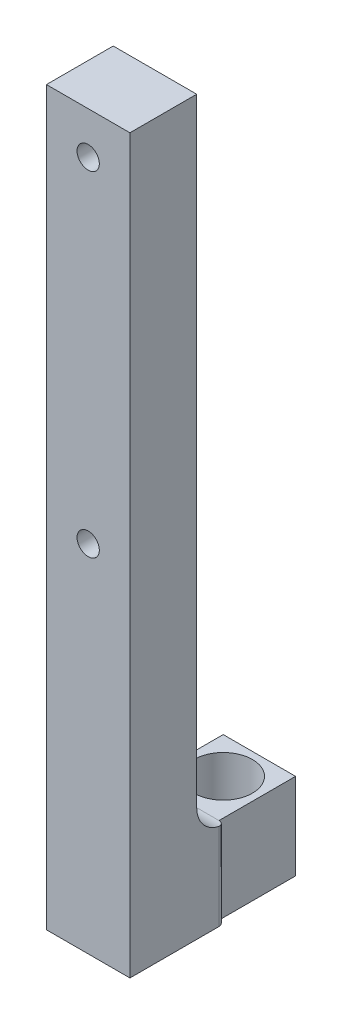
from build123d import *

# Parameters (mm, degrees)
SKETCH1_W           = 6.5
SKETCH1_H           = 6.5
SKETCH1_R           = 2.625
BOSS_EXTRUDE1_DEPTH = 7.75
SKETCH2_W           = 6.5
SKETCH2_H           = 7.75
BOSS_EXTRUDE2_DEPTH = 8.88
SKETCH3_W           = 6.5
SKETCH3_H           = 6
BOSS_EXTRUDE3_DEPTH = 58.01
FILLET1_R           = 2.5
BOSS_EXTRUDE4_START = 0.5
BOSS_EXTRUDE4_DEPTH = 0.5
FILLET2_R           = 0.5
FILLET3_R           = 0.5
SKETCH6_R           = 1
CUT_EXTRUDE3_DEPTH  = 67.53137982
CUT_EXTRUDE4_DEPTH  = 2


with BuildPart() as part:
    # Sketch1 → Boss-Extrude1 (new body)
    with BuildSketch(Plane(origin=(0, 0, 0), x_dir=(1, 0, 0), z_dir=(0, 1, 0))):
        Rectangle(SKETCH1_W, SKETCH1_H)
        with Locations(Location((0, 0, 0), (0, 0, 270))):
            Circle(SKETCH1_R, mode=Mode.SUBTRACT)
    extrude(amount=BOSS_EXTRUDE1_DEPTH)

    # Sketch2 → Boss-Extrude2 (add)
    with BuildSketch(Plane.XY.offset(3.25)):
        with Locations((0, 3.875)):
            Rectangle(SKETCH2_W, SKETCH2_H)
    extrude(amount=BOSS_EXTRUDE2_DEPTH)

    # Sketch3 → Boss-Extrude3 (add)
    with BuildSketch(Plane(origin=(0, 7.75, 0), x_dir=(1, 0, 0), z_dir=(0, 1, 0))):
        with Locations((0, -9.13)):
            Rectangle(SKETCH3_W, SKETCH3_H)
    extrude(amount=BOSS_EXTRUDE3_DEPTH)

    # Fillet1
    fillet1_edges = [part.edges().sort_by_distance(p)[0] for p in [
        (0, 7.75, 6.13),
    ]]
    fillet(fillet1_edges, radius=FILLET1_R)

    # Sketch4 → Boss-Extrude4 (add)
    with BuildSketch(Plane(origin=(3.25, 0, 0), x_dir=(0, 0, -1), z_dir=(1, 0, 0)).offset(BOSS_EXTRUDE4_START)):
        with BuildLine():
            Line((-3.63, 7.75), (-3.63, 0))
            Line((-3.63, 0), (-12.13, 0))
            Line((-12.13, 0), (-12.13, 65.76))
            Line((-12.13, 65.76), (-6.13, 65.76))
            Line((-6.13, 65.76), (-6.13, 10.25))
            ThreePointArc((-6.13, 10.25), (-5.397766953, 8.482233047), (-3.63, 7.75))
        make_face()
    boss_extrude4 = extrude(amount=-BOSS_EXTRUDE4_DEPTH)

    # Fillet2
    fillet2_edges = [part.edges().sort_by_distance(p)[0] for p in [
        (3.75, 3.875, 3.63),
    ]]
    fillet(fillet2_edges, radius=FILLET2_R - 0.0001)  # a hair under: the kernel refuses the full size

    # Mirror1: Boss-Extrude4 across plane
    add(boss_extrude4.mirror(Plane(origin=(0, 0, 0), x_dir=(0, 0, 1), z_dir=(1, 0, 0))))

    # Fillet3
    fillet3_edges = [part.edges().sort_by_distance(p)[0] for p in [
        (-3.75, 3.875, 3.63),
    ]]
    fillet(fillet3_edges, radius=FILLET3_R - 0.0001)  # a hair under: the kernel refuses the full size

    # Sketch6 → Cut-Extrude3 (cut, through all)
    with BuildSketch(Plane(origin=(0, 0, 6.13), x_dir=(-1, 0, 0), z_dir=(0, 0, -1))):
        with Locations((0, 61.975)):
            Circle(SKETCH6_R)
    cut_extrude3 = extrude(amount=-CUT_EXTRUDE3_DEPTH, mode=Mode.SUBTRACT)

    # Sketch6<3> → Cut-Extrude4 (cut)
    with BuildSketch(Plane(origin=(0, 0, 6.13), x_dir=(-1, 0, 0), z_dir=(0, 0, -1))):
        Polygon((2.25, 61.975), (1.125, 63.923557159), (-1.125, 63.923557159), (-2.25, 61.975), (-1.125, 60.026442841), (1.125, 60.026442841), align=None)
    cut_extrude4 = extrude(amount=-CUT_EXTRUDE4_DEPTH, mode=Mode.SUBTRACT)

    # Mirror2: Cut-Extrude3, Cut-Extrude4 across plane
    add(cut_extrude3.mirror(Plane.ZX.offset(46.94)), mode=Mode.SUBTRACT)
    add(cut_extrude4.mirror(Plane.ZX.offset(46.94)), mode=Mode.SUBTRACT)


solid = part.part
